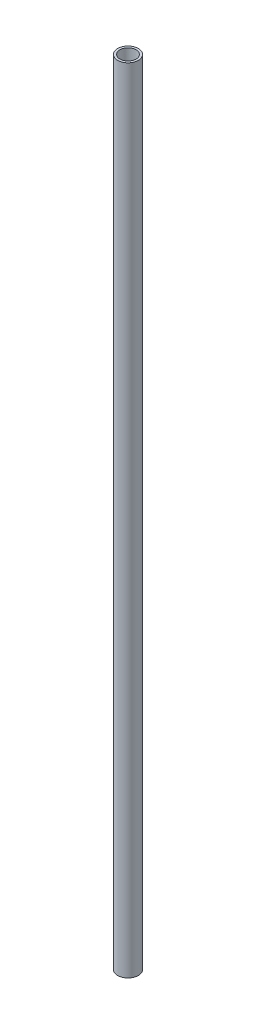
from build123d import *

# Parameters (mm, degrees)
SKETCH1_R           = 7.9375
SKETCH1_R_2         = 6.2103
BOSS_EXTRUDE1_DEPTH = 609.6


with BuildPart() as part:
    # Sketch1 → Boss-Extrude1 (new body)
    with BuildSketch(Plane(origin=(0, 0, 0), x_dir=(1, 0, 0), z_dir=(0, 1, 0))):
        Circle(SKETCH1_R)
        Circle(SKETCH1_R_2, mode=Mode.SUBTRACT)
    extrude(amount=BOSS_EXTRUDE1_DEPTH)


solid = part.part
